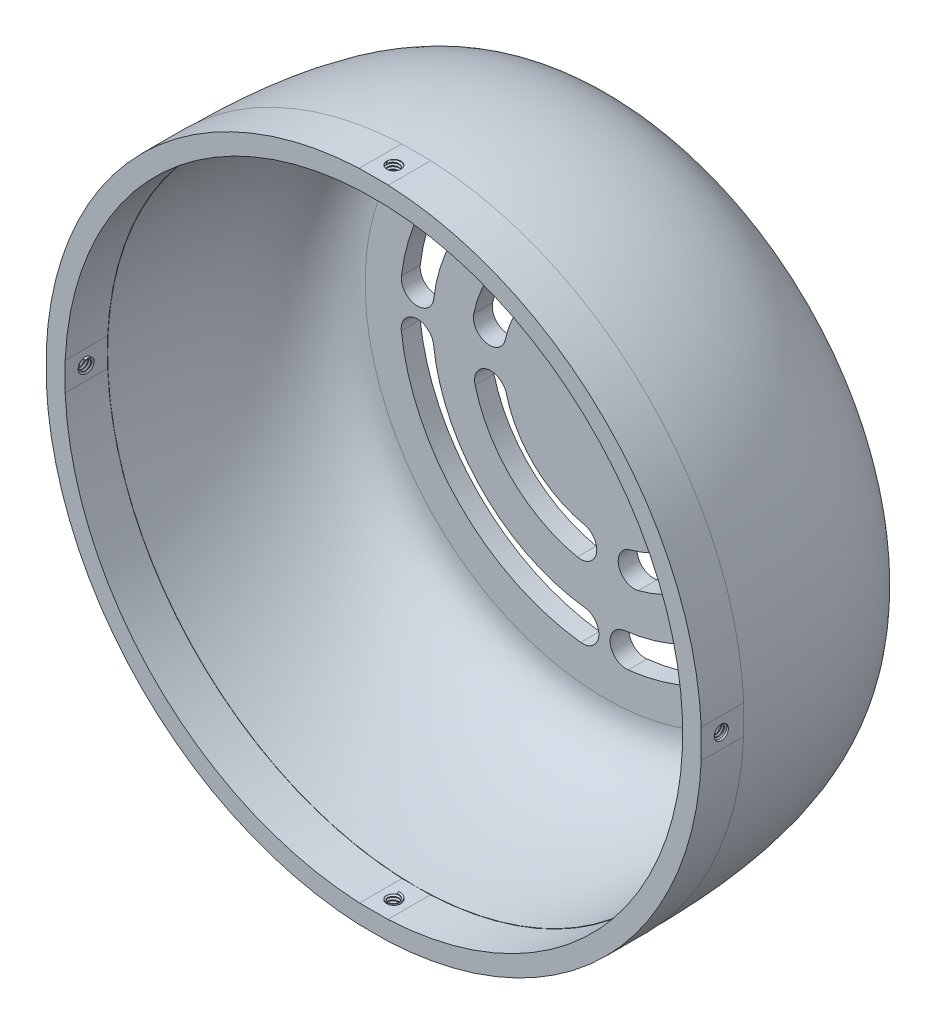
from build123d import *

# Parameters (mm, degrees)
BOSS_EXTRUDE1_DEPTH      = 2.5
BOSS_EXTRUDE1_DEPTH_BACK = 2
THICKEN1_START           = -24
THICKEN1_OUTLINE_R       = 25.418866194
THICKEN1_DEPTH           = 2
CUT_EXTRUDE1_DEPTH       = 56.771229266
CIRPATTERN1_COUNT        = 4
SKETCH7_R                = 0.75
CUT_EXTRUDE2_DEPTH       = 82.218532526
CIRPATTERN2_COUNT        = 3
CIRPATTERN2_ANGLE        = 180
THREAD1_PITCH            = 0.3175
THREAD2_PITCH            = 0.3175
THREAD3_PITCH            = 0.3175
THREAD4_PITCH            = 0.3175


with BuildPart() as part:
    # Sketch1 → Boss-Extrude1 (new, two sides: drawn at the far end of the back side and taken through both)
    with BuildSketch(Plane.XY.offset(-BOSS_EXTRUDE1_DEPTH_BACK)):
        with BuildLine():
            Line((-34.7, 1.545167422), (-34.7, -1.545167422))
            ThreePointArc((-34.7, -1.545167422), (-24.560919592, -24.560919592), (-1.545167422, -34.7))
            Line((-1.545167422, -34.7), (1.545167422, -34.7))
            ThreePointArc((1.545167422, -34.7), (24.560919592, -24.560919592), (34.7, -1.545167422))
            Line((34.7, -1.545167422), (34.7, 1.545167422))
            ThreePointArc((34.7, 1.545167422), (24.560919592, 24.560919592), (1.545167422, 34.7))
            Line((1.545167422, 34.7), (-1.545167422, 34.7))
            ThreePointArc((-1.545167422, 34.7), (-24.560919592, 24.560919592), (-34.7, 1.545167422))
        make_face()
        with BuildLine():
            Line((-32.7, 1.5), (-32.7, -1.5))
            ThreePointArc((-32.7, -1.5), (-23.146706029, -23.146706029), (-1.5, -32.7))
            Line((-1.5, -32.7), (1.5, -32.7))
            ThreePointArc((1.5, -32.7), (23.146706029, -23.146706029), (32.7, -1.5))
            Line((32.7, -1.5), (32.7, 1.5))
            ThreePointArc((32.7, 1.5), (23.146706029, 23.146706029), (1.5, 32.7))
            Line((1.5, 32.7), (-1.5, 32.7))
            ThreePointArc((-1.5, 32.7), (-23.146706029, 23.146706029), (-32.7, 1.5))
        make_face(mode=Mode.SUBTRACT)
    extrude(amount=BOSS_EXTRUDE1_DEPTH + BOSS_EXTRUDE1_DEPTH_BACK)

    # Sketch3 → Revolve1 (revolve)
    with BuildSketch(Plane(origin=(0, 0, 0), x_dir=(0, 0, -1), z_dir=(1, 0, 0)), mode=Mode.PRIVATE) as revolve1_sk:
        with BuildLine():
            Line((2, 34.7), (2, 32.7))
            add(Edge.make_bspline(
                [(2, 32.7), (22, 32.7), (22, 25.418866194)],
                knots=[0, 0, 0, 1, 1, 1], degree=2))
            Line((22, 25.418866194), (24, 25.418866194))
            add(Edge.make_bspline(
                [(2, 34.7), (24, 34.7), (24, 25.418866194)],
                knots=[0, 0, 0, 1, 1, 1], degree=2))
        make_face()
    revolve(revolve1_sk.sketch.rotate(Axis((0, 0, 13.911693562), (0, 0, -1)), 90), axis=Axis((0, 0, 13.911693562), (0, 0, -1)))

    # Thicken1: read off the stored shape, not the designer's step
    # Thicken1 outline → Thicken1 (add)
    with BuildSketch(Plane.XY.offset(THICKEN1_START)):
        Circle(THICKEN1_OUTLINE_R)
    extrude(amount=THICKEN1_DEPTH)

    # Sketch5 → Cut-Extrude1 (cut, symmetric)
    with BuildSketch(Plane(origin=(0, 0, -24), x_dir=(-1, 0, 0), z_dir=(0, 0, -1))):
        with BuildLine():
            ThreePointArc((-2.574219326, 21.56927349), (-15.399712372, 15.320216149), (-21.582307516, 2.462552799))
            ThreePointArc((-21.582307516, 2.462552799), (-20.066321555, 0.55606021), (-18.159828966, 2.072046171))
            ThreePointArc((-18.159828966, 2.072046171), (-12.95765722, 12.890767347), (-2.166004847, 18.148861849))
            ThreePointArc((-2.166004847, 18.148861849), (-0.659906266, 20.063174909), (-2.574219326, 21.56927349))
        make_face()
        with BuildLine():
            ThreePointArc((-2.933416369, 13.905308322), (-9.826546942, 10.266523576), (-13.763576116, 3.539280099))
            ThreePointArc((-13.763576116, 3.539280099), (-12.532351166, 1.455644389), (-10.448715456, 2.686869339))
            ThreePointArc((-10.448715456, 2.686869339), (-7.459892112, 7.793903463), (-2.226923635, 10.556312455))
            ThreePointArc((-2.226923635, 10.556312455), (-0.905672069, 12.584056756), (-2.933416369, 13.905308322))
        make_face()
    cut_extrude1 = extrude(amount=CUT_EXTRUDE1_DEPTH, both=True, mode=Mode.SUBTRACT)

    # CirPattern1: Cut-Extrude1 ×4 about axis
    cirpattern1_axis = Axis((0, 0, 0), (0, 0, 1))
    for i in range(1, CIRPATTERN1_COUNT):
        add(cut_extrude1.rotate(cirpattern1_axis, i * 360 / CIRPATTERN1_COUNT), mode=Mode.SUBTRACT)

    # Sketch7 → Cut-Extrude2 (cut, symmetric)
    with BuildSketch(Plane(origin=(0, 34.7, 0), x_dir=(1, 0, 0), z_dir=(0, 1, 0))):
        with Locations(Location((0, -0.373777428, 0), (0, 0, 270))):
            Circle(SKETCH7_R)
    cut_extrude2 = extrude(amount=CUT_EXTRUDE2_DEPTH, both=True, mode=Mode.SUBTRACT)

    # CirPattern2: Cut-Extrude2 ×3 about axis
    cirpattern2_axis = Axis((0, 0, 13.911693562), (0, 0, -1))
    for i in range(1, CIRPATTERN2_COUNT):
        add(cut_extrude2.rotate(cirpattern2_axis, i * CIRPATTERN2_ANGLE / (CIRPATTERN2_COUNT - 1)), mode=Mode.SUBTRACT)

    # Thread1: arcs per turn and ends read off the stored shape
    # Thread1: the profile of Thread Profile1 profile screwed along a right-hand helix through 6.299213 turns, 6 arcs to a turn; built about Z, then put on its axis
    thread1_z = Axis((0, 0, 0), (0, 0, 1))
    thread1_corners = [(0.7503, 0, -0.000173205), (0.7503, 0, 0.277985704), (0.578148085, 0, 0.17859375), (0.578148085, 0, 0.09921875)]
    with BuildLine(mode=Mode.PRIVATE) as thread1_profile:
        Line(thread1_corners[0], thread1_corners[1])
        Line(thread1_corners[1], thread1_corners[2])
        Line(thread1_corners[2], thread1_corners[3])
        Line(thread1_corners[3], thread1_corners[0])
    thread1_cap = Face(thread1_profile.wire())
    thread1_turn_angles = [0, 30, 60, 90, 120, 150, 180, 210, 240, 270, 300, 330, 360]
    thread1_turn_weights = [1, 0.8660254037844387, 1, 0.8660254037844387, 1, 0.8660254037844387, 1, 0.8660254037844387, 1, 0.8660254037844387, 1, 0.8660254037844387, 1]
    thread1_turn_rails = [Edge.make_bspline([Vector(p[0], p[1], 0).rotate(thread1_z, thread1_turn_angles[k]) / thread1_turn_weights[k] + Vector(0, 0, p[2] + THREAD1_PITCH * thread1_turn_angles[k] / 360) for k in range(13)], [0, 0, 0, 1, 1, 2, 2, 3, 3, 4, 4, 5, 5, 6, 6, 6], 2, thread1_turn_weights) for p in thread1_corners]
    thread1_turn_sides = [Face.make_surface_from_curves(thread1_turn_rails[p[0]], thread1_turn_rails[p[1]]) for p in [(0, 1), (1, 2), (2, 3), (3, 0)]]
    thread1_last_angles = [2160, 2190, 2220, 2243.858267717, 2267.716535433]
    thread1_last_weights = [1, 0.8660254037844387, 1, 0.9145488039507501, 1]
    thread1_last_rails = [Edge.make_bspline([Vector(p[0], p[1], 0).rotate(thread1_z, thread1_last_angles[k]) / thread1_last_weights[k] + Vector(0, 0, p[2] + THREAD1_PITCH * thread1_last_angles[k] / 360) for k in range(5)], [0, 0, 0, 1, 1, 2, 2, 2], 2, thread1_last_weights) for p in thread1_corners]
    thread1_last_sides = [Face.make_surface_from_curves(thread1_last_rails[p[0]], thread1_last_rails[p[1]]) for p in [(0, 1), (1, 2), (2, 3), (3, 0)]]
    thread1 = Plane(origin=(0, 34.7, 0.373777428), x_dir=(-1, 0, 0), z_dir=(0, -1, 0)) * Solid(Shell([*[p.moved(Location((0, 0, THREAD1_PITCH * i))) for i in range(6) for p in thread1_turn_sides], *thread1_last_sides, thread1_cap, thread1_cap.rotate(thread1_z, 2267.716535433).moved(Location((0, 0, THREAD1_PITCH * 2267.716535433 / 360)))]))
    add(thread1)

    # Thread2: arcs per turn and ends read off the stored shape
    # Thread2: the profile of Thread Profile2 profile screwed along a right-hand helix through 6.299213 turns, 6 arcs to a turn; built about Z, then put on its axis
    thread2_z = Axis((0, 0, 0), (0, 0, 1))
    thread2_corners = [(0.7503, 0, -0.000173205), (0.7503, 0, 0.277985704), (0.578148085, 0, 0.17859375), (0.578148085, 0, 0.09921875)]
    with BuildLine(mode=Mode.PRIVATE) as thread2_profile:
        Line(thread2_corners[0], thread2_corners[1])
        Line(thread2_corners[1], thread2_corners[2])
        Line(thread2_corners[2], thread2_corners[3])
        Line(thread2_corners[3], thread2_corners[0])
    thread2_cap = Face(thread2_profile.wire())
    thread2_turn_angles = [0, 30, 60, 90, 120, 150, 180, 210, 240, 270, 300, 330, 360]
    thread2_turn_weights = [1, 0.8660254037844387, 1, 0.8660254037844387, 1, 0.8660254037844387, 1, 0.8660254037844387, 1, 0.8660254037844387, 1, 0.8660254037844387, 1]
    thread2_turn_rails = [Edge.make_bspline([Vector(p[0], p[1], 0).rotate(thread2_z, thread2_turn_angles[k]) / thread2_turn_weights[k] + Vector(0, 0, p[2] + THREAD2_PITCH * thread2_turn_angles[k] / 360) for k in range(13)], [0, 0, 0, 1, 1, 2, 2, 3, 3, 4, 4, 5, 5, 6, 6, 6], 2, thread2_turn_weights) for p in thread2_corners]
    thread2_turn_sides = [Face.make_surface_from_curves(thread2_turn_rails[p[0]], thread2_turn_rails[p[1]]) for p in [(0, 1), (1, 2), (2, 3), (3, 0)]]
    thread2_last_angles = [2160, 2190, 2220, 2243.858267717, 2267.716535433]
    thread2_last_weights = [1, 0.8660254037844387, 1, 0.9145488039507501, 1]
    thread2_last_rails = [Edge.make_bspline([Vector(p[0], p[1], 0).rotate(thread2_z, thread2_last_angles[k]) / thread2_last_weights[k] + Vector(0, 0, p[2] + THREAD2_PITCH * thread2_last_angles[k] / 360) for k in range(5)], [0, 0, 0, 1, 1, 2, 2, 2], 2, thread2_last_weights) for p in thread2_corners]
    thread2_last_sides = [Face.make_surface_from_curves(thread2_last_rails[p[0]], thread2_last_rails[p[1]]) for p in [(0, 1), (1, 2), (2, 3), (3, 0)]]
    thread2 = Plane(origin=(34.7, 0, 0.373777428), x_dir=(0, 0, 1), z_dir=(-1, 0, 0)) * Solid(Shell([*[p.moved(Location((0, 0, THREAD2_PITCH * i))) for i in range(6) for p in thread2_turn_sides], *thread2_last_sides, thread2_cap, thread2_cap.rotate(thread2_z, 2267.716535433).moved(Location((0, 0, THREAD2_PITCH * 2267.716535433 / 360)))]))
    add(thread2)

    # Thread3: arcs per turn and ends read off the stored shape
    # Thread3: the profile of Thread Profile3 profile screwed along a right-hand helix through 6.299213 turns, 6 arcs to a turn; built about Z, then put on its axis
    thread3_z = Axis((0, 0, 0), (0, 0, 1))
    thread3_corners = [(0.7503, 0, -0.000173205), (0.7503, 0, 0.277985704), (0.578148085, 0, 0.17859375), (0.578148085, 0, 0.09921875)]
    with BuildLine(mode=Mode.PRIVATE) as thread3_profile:
        Line(thread3_corners[0], thread3_corners[1])
        Line(thread3_corners[1], thread3_corners[2])
        Line(thread3_corners[2], thread3_corners[3])
        Line(thread3_corners[3], thread3_corners[0])
    thread3_cap = Face(thread3_profile.wire())
    thread3_turn_angles = [0, 30, 60, 90, 120, 150, 180, 210, 240, 270, 300, 330, 360]
    thread3_turn_weights = [1, 0.8660254037844387, 1, 0.8660254037844387, 1, 0.8660254037844387, 1, 0.8660254037844387, 1, 0.8660254037844387, 1, 0.8660254037844387, 1]
    thread3_turn_rails = [Edge.make_bspline([Vector(p[0], p[1], 0).rotate(thread3_z, thread3_turn_angles[k]) / thread3_turn_weights[k] + Vector(0, 0, p[2] + THREAD3_PITCH * thread3_turn_angles[k] / 360) for k in range(13)], [0, 0, 0, 1, 1, 2, 2, 3, 3, 4, 4, 5, 5, 6, 6, 6], 2, thread3_turn_weights) for p in thread3_corners]
    thread3_turn_sides = [Face.make_surface_from_curves(thread3_turn_rails[p[0]], thread3_turn_rails[p[1]]) for p in [(0, 1), (1, 2), (2, 3), (3, 0)]]
    thread3_last_angles = [2160, 2190, 2220, 2243.858267717, 2267.716535433]
    thread3_last_weights = [1, 0.8660254037844387, 1, 0.9145488039507501, 1]
    thread3_last_rails = [Edge.make_bspline([Vector(p[0], p[1], 0).rotate(thread3_z, thread3_last_angles[k]) / thread3_last_weights[k] + Vector(0, 0, p[2] + THREAD3_PITCH * thread3_last_angles[k] / 360) for k in range(5)], [0, 0, 0, 1, 1, 2, 2, 2], 2, thread3_last_weights) for p in thread3_corners]
    thread3_last_sides = [Face.make_surface_from_curves(thread3_last_rails[p[0]], thread3_last_rails[p[1]]) for p in [(0, 1), (1, 2), (2, 3), (3, 0)]]
    thread3 = Plane(origin=(0, -34.7, 0.373777428), x_dir=(1, 0, 0), z_dir=(0, 1, 0)) * Solid(Shell([*[p.moved(Location((0, 0, THREAD3_PITCH * i))) for i in range(6) for p in thread3_turn_sides], *thread3_last_sides, thread3_cap, thread3_cap.rotate(thread3_z, 2267.716535433).moved(Location((0, 0, THREAD3_PITCH * 2267.716535433 / 360)))]))
    add(thread3)

    # Thread4: arcs per turn and ends read off the stored shape
    # Thread4: the profile of Thread Profile4 profile screwed along a right-hand helix through 6.299213 turns, 6 arcs to a turn; built about Z, then put on its axis
    thread4_z = Axis((0, 0, 0), (0, 0, 1))
    thread4_corners = [(0.7503, 0, -0.000173205), (0.7503, 0, 0.277985704), (0.578148085, 0, 0.17859375), (0.578148085, 0, 0.09921875)]
    with BuildLine(mode=Mode.PRIVATE) as thread4_profile:
        Line(thread4_corners[0], thread4_corners[1])
        Line(thread4_corners[1], thread4_corners[2])
        Line(thread4_corners[2], thread4_corners[3])
        Line(thread4_corners[3], thread4_corners[0])
    thread4_cap = Face(thread4_profile.wire())
    thread4_turn_angles = [0, 30, 60, 90, 120, 150, 180, 210, 240, 270, 300, 330, 360]
    thread4_turn_weights = [1, 0.8660254037844387, 1, 0.8660254037844387, 1, 0.8660254037844387, 1, 0.8660254037844387, 1, 0.8660254037844387, 1, 0.8660254037844387, 1]
    thread4_turn_rails = [Edge.make_bspline([Vector(p[0], p[1], 0).rotate(thread4_z, thread4_turn_angles[k]) / thread4_turn_weights[k] + Vector(0, 0, p[2] + THREAD4_PITCH * thread4_turn_angles[k] / 360) for k in range(13)], [0, 0, 0, 1, 1, 2, 2, 3, 3, 4, 4, 5, 5, 6, 6, 6], 2, thread4_turn_weights) for p in thread4_corners]
    thread4_turn_sides = [Face.make_surface_from_curves(thread4_turn_rails[p[0]], thread4_turn_rails[p[1]]) for p in [(0, 1), (1, 2), (2, 3), (3, 0)]]
    thread4_last_angles = [2160, 2190, 2220, 2243.858267717, 2267.716535433]
    thread4_last_weights = [1, 0.8660254037844387, 1, 0.9145488039507501, 1]
    thread4_last_rails = [Edge.make_bspline([Vector(p[0], p[1], 0).rotate(thread4_z, thread4_last_angles[k]) / thread4_last_weights[k] + Vector(0, 0, p[2] + THREAD4_PITCH * thread4_last_angles[k] / 360) for k in range(5)], [0, 0, 0, 1, 1, 2, 2, 2], 2, thread4_last_weights) for p in thread4_corners]
    thread4_last_sides = [Face.make_surface_from_curves(thread4_last_rails[p[0]], thread4_last_rails[p[1]]) for p in [(0, 1), (1, 2), (2, 3), (3, 0)]]
    thread4 = Plane(origin=(-34.7, 0, 0.373777428), x_dir=(0, 0, -1), z_dir=(1, 0, 0)) * Solid(Shell([*[p.moved(Location((0, 0, THREAD4_PITCH * i))) for i in range(6) for p in thread4_turn_sides], *thread4_last_sides, thread4_cap, thread4_cap.rotate(thread4_z, 2267.716535433).moved(Location((0, 0, THREAD4_PITCH * 2267.716535433 / 360)))]))
    add(thread4)


solid = part.part
